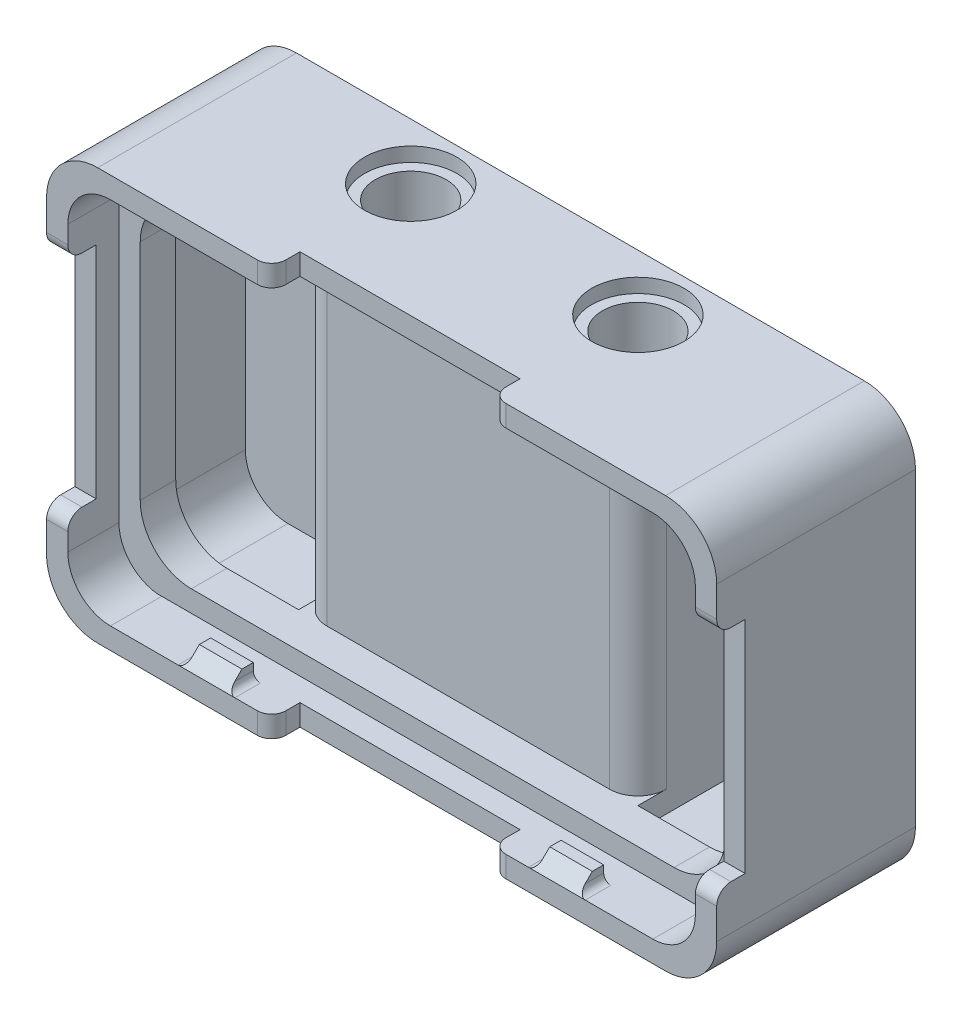
from build123d import *

# Parameters (mm, degrees)
SKETCH1_W               = 47.2
SKETCH1_H               = 29
SKETCH1_W_2             = 44.2
SKETCH1_H_2             = 26
BOSS_EXTRUDE2_DEPTH     = 14
SKETCH2_W               = 44.2
SKETCH2_H               = 26
BOSS_EXTRUDE3_DEPTH     = 1.5
SKETCH3_W               = 23.9
SKETCH3_H               = 7.9
SKETCH3_R               = 2.45
BOSS_EXTRUDE4_DEPTH     = 29
SKETCH4_R               = 2.5
CUT_EXTRUDE1_DEPTH      = 29
SKETCH5_R               = 3.25
CUT_EXTRUDE2_DEPTH      = 1
CUT_EXTRUDE3_START      = -1
SKETCH6_R               = 3.25
CUT_EXTRUDE3_DEPTH      = 1
CUT_EXTRUDE4_DEPTH      = 7.5
CUT_EXTRUDE4_DEPTH_BACK = 7.5
SKETCH8_R               = 3.25
SKETCH9_W               = 44.2
SKETCH9_H               = 25.968378764
SKETCH9_W_2             = 41.2
SKETCH9_H_2             = 22.968378764
BOSS_EXTRUDE5_DEPTH     = 2.5
SKETCH10_W              = 15.5
SKETCH10_H              = 1.5
SKETCH10_W_2            = 1.5
SKETCH10_H_2            = 15.5
CUT_EXTRUDE6_DEPTH      = 2
FILLET1_R               = 2
BOSS_EXTRUDE6_DEPTH     = 1.8
CUT_EXTRUDE7_REACH      = 44.52
FILLET2_R               = 0.5
FILLET3_R               = 3.6
FILLET4_R               = 1
FILLET5_R               = 3


with BuildPart() as part:
    # Sketch1 → Boss-Extrude2 (new body)
    with BuildSketch(Plane.XY):
        Rectangle(SKETCH1_W, SKETCH1_H)
        Rectangle(SKETCH1_W_2, SKETCH1_H_2, mode=Mode.SUBTRACT)
    extrude(amount=BOSS_EXTRUDE2_DEPTH)

    # Sketch2 → Boss-Extrude3 (add)
    with BuildSketch(Plane(origin=(0, 0, 0), x_dir=(-1, 0, 0), z_dir=(0, 0, -1))):
        Rectangle(SKETCH2_W, SKETCH2_H)
    extrude(amount=-BOSS_EXTRUDE3_DEPTH)

    # Sketch3 → Boss-Extrude4 (add)
    with BuildSketch(Plane.XZ.offset(14.5)):
        with Locations((0, 3.95)):
            Rectangle(SKETCH3_W, SKETCH3_H)
        with Locations(Location((-8, 3.95, 0), (0, 0, 90))):
            Circle(SKETCH3_R, mode=Mode.SUBTRACT)
        with Locations(Location((8, 3.95, 0), (0, 0, 90))):
            Circle(SKETCH3_R, mode=Mode.SUBTRACT)
    extrude(amount=-BOSS_EXTRUDE4_DEPTH)

    # Sketch4 → Cut-Extrude1 (cut)
    with BuildSketch(Plane.XZ.offset(14.5)):
        with Locations(Location((-8, 3.95, 0), (0, 0, 270))):
            Circle(SKETCH4_R)
        with Locations(Location((8, 3.95, 0), (0, 0, 270))):
            Circle(SKETCH4_R)
    extrude(amount=-CUT_EXTRUDE1_DEPTH, mode=Mode.SUBTRACT)

    # Sketch5 → Cut-Extrude2 (cut)
    with BuildSketch(Plane.XZ.offset(14.5)):
        with Locations(Location((-8, 3.95, 0), (0, 0, 270))):
            Circle(SKETCH5_R)
        with Locations(Location((8, 3.95, 0), (0, 0, 270))):
            Circle(SKETCH5_R)
    extrude(amount=-CUT_EXTRUDE2_DEPTH, mode=Mode.SUBTRACT)

    # Sketch6 → Cut-Extrude3 (cut)
    with BuildSketch(Plane(origin=(0, 14.5, 0), x_dir=(1, 0, 0), z_dir=(0, 1, 0)).offset(CUT_EXTRUDE3_START)):
        with Locations(Location((-8, -3.95, 0), (0, 0, 90))):
            Circle(SKETCH6_R)
        with Locations(Location((8, -3.95, 0), (0, 0, 90))):
            Circle(SKETCH6_R)
    extrude(amount=CUT_EXTRUDE3_DEPTH, mode=Mode.SUBTRACT)

    # Sketch8 → Cut-Extrude4 (cut, two sides: drawn at the far end of the back side and taken through both)
    with BuildSketch(Plane(origin=(0, 0, 0), x_dir=(1, 0, 0), z_dir=(0, 1, 0)).offset(-CUT_EXTRUDE4_DEPTH_BACK)):
        with Locations(Location((-8, -3.95, 0), (0, 0, 90))):
            Circle(SKETCH8_R)
        with Locations(Location((8, -3.95, 0), (0, 0, 90))):
            Circle(SKETCH8_R)
    extrude(amount=CUT_EXTRUDE4_DEPTH + CUT_EXTRUDE4_DEPTH_BACK, mode=Mode.SUBTRACT)

    # Sketch9 → Boss-Extrude5 (add)
    with BuildSketch(Plane.XY.offset(7.9)):
        Rectangle(SKETCH9_W, SKETCH9_H)
        Rectangle(SKETCH9_W_2, SKETCH9_H_2, mode=Mode.SUBTRACT)
    extrude(amount=BOSS_EXTRUDE5_DEPTH)

    # Sketch10 → Cut-Extrude6 (cut)
    with BuildSketch(Plane.XY.offset(14)):
        with Locations((0, 13.75)):
            Rectangle(SKETCH10_W, SKETCH10_H)
        with Locations((22.85, 0)):
            Rectangle(SKETCH10_W_2, SKETCH10_H_2)
        with Locations((0, -13.75)):
            Rectangle(SKETCH10_W, SKETCH10_H)
        with Locations((-22.85, 0)):
            Rectangle(SKETCH10_W_2, SKETCH10_H_2)
    extrude(amount=-CUT_EXTRUDE6_DEPTH, mode=Mode.SUBTRACT)

    # Fillet1
    fillet1_edges = [part.edges().sort_by_distance(p)[0] for p in [
        (11.95, 0, 7.9),
        (-11.95, 0, 7.9),
    ]]
    fillet(fillet1_edges, radius=FILLET1_R)

    # Sketch12 → Boss-Extrude6 (add)
    with BuildSketch(Plane.XY.offset(14)):
        Polygon((-10.839591229, 12), (-10.839591229, 13), (-12.339591229, 13), (-13.839591229, 13), (-13.839591229, 12), align=None)
        Polygon((-10.839591229, -13), (-10.839591229, -12), (-13.839591229, -12), (-13.839591229, -13), (-12.339591229, -13), align=None)
        Polygon((10.839591229, -12), (10.839591229, -13), (12.339591229, -13), (13.839591229, -13), (13.839591229, -12), align=None)
        Polygon((10.839591229, 13), (10.839591229, 12), (13.839591229, 12), (13.839591229, 13), (12.339591229, 13), align=None)
    extrude(amount=-BOSS_EXTRUDE6_DEPTH)

    # Cut-Extrude7: up to this face of the body (flat: up to its plane)
    cut_extrude7_end = Plane(part.part.faces().sort_by_distance((13.839591229, -12.5, 13.1))[0])
    # Sketch13 → Cut-Extrude7 (cut, up to the picked face)
    with BuildSketch(Plane.ZY.offset(13.839591229), mode=Mode.PRIVATE) as cut_extrude7_sk1:
        Polygon((14, 13), (14, 12), (13, 12), align=None)
    cut_extrude7_tool1 = split(extrude(cut_extrude7_sk1.sketch, amount=-CUT_EXTRUDE7_REACH, mode=Mode.PRIVATE), bisect_by=cut_extrude7_end, keep=Keep.BOTH, mode=Mode.PRIVATE)
    # Sketch13 → Cut-Extrude7 (cut, up to the picked face)
    with BuildSketch(Plane.ZY.offset(13.839591229), mode=Mode.PRIVATE) as cut_extrude7_sk2:
        Polygon((14, -13), (14, -12), (13, -12), align=None)
    cut_extrude7_tool2 = split(extrude(cut_extrude7_sk2.sketch, amount=-CUT_EXTRUDE7_REACH, mode=Mode.PRIVATE), bisect_by=cut_extrude7_end, keep=Keep.BOTH, mode=Mode.PRIVATE)
    add(cut_extrude7_tool1.solids().sort_by(Axis((-13.839591, 12.333333, 13.666667), (1, 0, 0)))[0], mode=Mode.SUBTRACT)
    add(cut_extrude7_tool2.solids().sort_by(Axis((-13.839591, -12.333333, 13.666667), (1, 0, 0)))[0], mode=Mode.SUBTRACT)

    # Fillet2
    fillet2_edges = [part.edges().sort_by_distance(p)[0] for p in [
        (-13.839591229, 13, 13.1),
        (-10.839591229, 13, 13.1),
        (10.839591229, 13, 13.1),
        (13.839591229, 13, 13.1),
        (13.839591229, -13, 13.1),
        (10.839591229, -13, 13.1),
        (-10.839591229, -13, 13.1),
        (-13.839591229, -13, 13.1),
    ]]
    fillet(fillet2_edges, radius=FILLET2_R)

    # Fillet3
    fillet3_edges = [part.edges().sort_by_distance(p)[0] for p in [
        (20.6, -11.484189382, 9.15),
        (-20.6, -11.484189382, 9.15),
        (-20.6, 11.484189382, 9.15),
        (20.6, 11.484189382, 9.15),
        (-23.6, 14.5, 7),
        (23.6, 14.5, 7),
        (23.6, -14.5, 7),
        (-23.6, -14.5, 7),
    ]]
    fillet(fillet3_edges, radius=FILLET3_R)

    # Fillet4
    fillet4_edges = [part.edges().sort_by_distance(p)[0] for p in [
        (-22.85, 7.75, 14),
        (-22.85, -7.75, 14),
        (-7.75, 13.75, 14),
        (7.75, 13.75, 14),
        (22.85, 7.75, 14),
        (22.85, -7.75, 14),
        (-7.75, -13.75, 14),
        (7.75, -13.75, 14),
    ]]
    fillet(fillet4_edges, radius=FILLET4_R)

    # Fillet5
    # the kernel refuses this fillet: 3 mm, written as the material it adds along each edge
    with BuildSketch(Plane(origin=(22.1, 13, 1.5), x_dir=(0, -1, 0), z_dir=(0, 0, 1)), Plane(origin=(22.1, -13, 1.5), x_dir=(-1, 0, 0), z_dir=(0, 0, 1))) as fillet5_piece_1:
        with BuildLine():
            CenterArc((FILLET5_R, -FILLET5_R), FILLET5_R, 90, 90)
            Line((0, -FILLET5_R), (0, 0))
            Line((0, 0), (FILLET5_R, 0))
        make_face()
    extrude(amount=12.5)
    with BuildSketch(Plane(origin=(-22.1, 13, 1.5), x_dir=(0, -1, 0), z_dir=(0, 0, 1)), Plane(origin=(-22.1, -13, 1.5), x_dir=(1, 0, 0), z_dir=(0, 0, 1))) as fillet5_piece_2:
        with BuildLine():
            CenterArc((FILLET5_R, FILLET5_R), FILLET5_R, 180, 90)
            Line((0, FILLET5_R), (0, 0))
            Line((0, 0), (FILLET5_R, 0))
        make_face()
    extrude(amount=12.5)


solid = part.part
